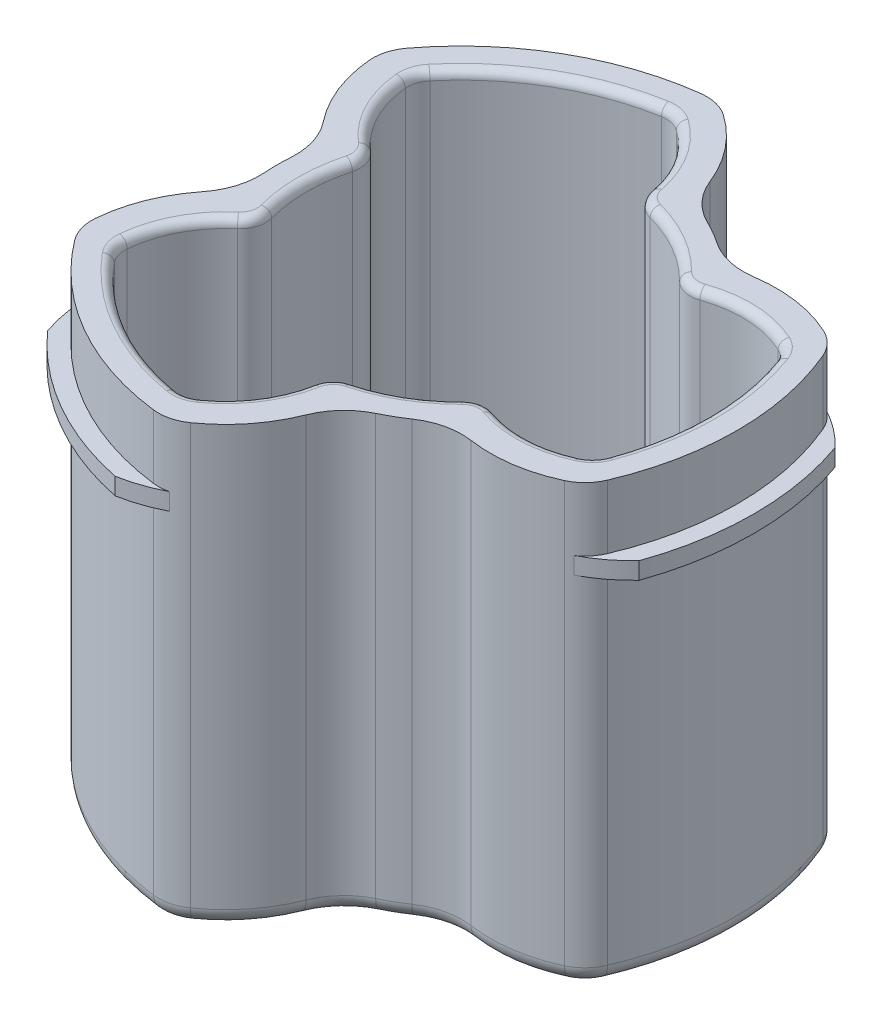
from build123d import *

# Parameters (mm, degrees)
DODANIE_WYCI_GNI_CIE1_DEPTH = 44.5
DODANIE_WYCI_GNI_CIE2_START = -7
DODANIE_WYCI_GNI_CIE2_DEPTH = 7
SZKIC2_R                    = 6.5
WYTNIJ_WYCI_GNI_CIE1_DEPTH  = 17
ZAOKR_GLENIE1_R             = 3
ZAOKR_GLENIE4_R             = 2
SFAZOWANIE2_SIZE            = 0.5
ZAOKR_GLENIE5_R             = 1
ZAOKR_GLENIE8_R             = 5
ZAOKR_GLENIE9_R             = 8
ZAOKR_GLENIE10_R            = 2
SZKIC3_W                    = 4
SZKIC3_H                    = 2
WYTNIJ_WYCI_GNI_CIE2_START  = -9.5
WYTNIJ_WYCI_GNI_CIE2_DEPTH  = 2


# Read off the part's stored shape, not the designer's step: Wytnij-wyciągnięcie2
with BuildPart() as part:
    # Szkic1 → Dodanie-wyciągnięcie1 (new body)
    with BuildSketch(Plane(origin=(0, 0, 0), x_dir=(1, 0, 0), z_dir=(0, 1, 0))):
        with BuildLine():
            ThreePointArc((29.172844828, -14.324633491), (32.5, 0), (29.172844828, 14.324633491))
            ThreePointArc((29.172844828, 14.324633491), (22.143469635, 16.74885428), (14.755110837, 15.911527399))
            ThreePointArc((14.755110837, 15.911527399), (10.85, 18.792751262), (6.402231522, 20.73406452))
            ThreePointArc((6.402231522, 20.73406452), (3.433198473, 27.551234372), (-2.18092591, 32.426741467))
            ThreePointArc((-2.18092591, 32.426741467), (-16.25, 28.145825623), (-26.991918917, 18.102107976))
            ThreePointArc((-26.991918917, 18.102107976), (-25.576668109, 10.802380092), (-21.157342359, 4.822537121))
            ThreePointArc((-21.157342359, 4.822537121), (-21.7, 0), (-21.157342359, -4.822537121))
            ThreePointArc((-21.157342359, -4.822537121), (-25.576668109, -10.802380092), (-26.991918917, -18.102107976))
            ThreePointArc((-26.991918917, -18.102107976), (-16.25, -28.145825623), (-2.18092591, -32.426741467))
            ThreePointArc((-2.18092591, -32.426741467), (3.433198473, -27.551234372), (6.402231522, -20.73406452))
            ThreePointArc((6.402231522, -20.73406452), (10.85, -18.792751262), (14.755110837, -15.911527399))
            ThreePointArc((14.755110837, -15.911527399), (22.143469635, -16.74885428), (29.172844828, -14.324633491))
        make_face()
        with BuildLine():
            ThreePointArc((26.797229064, -11.086411254), (29, 0), (26.797229064, 11.086411254))
            ThreePointArc((26.797229064, 11.086411254), (20.551461681, 12.847539337), (14.241564039, 11.332160152))
            ThreePointArc((14.241564039, 11.332160152), (9.1, 15.761662349), (2.693156552, 17.999636324))
            ThreePointArc((2.693156552, 17.999636324), (0.850564602, 24.22185757), (-3.797500749, 28.750286747))
            ThreePointArc((-3.797500749, 28.750286747), (-14.5, 25.11473671), (-22.999728315, 17.663875494))
            ThreePointArc((-22.999728315, 17.663875494), (-21.402026283, 11.374318232), (-16.934720591, 6.667476172))
            ThreePointArc((-16.934720591, 6.667476172), (-18.2, 0), (-16.934720591, -6.667476172))
            ThreePointArc((-16.934720591, -6.667476172), (-21.402026283, -11.374318232), (-22.999728315, -17.663875494))
            ThreePointArc((-22.999728315, -17.663875494), (-14.5, -25.11473671), (-3.797500749, -28.750286747))
            ThreePointArc((-3.797500749, -28.750286747), (0.850564602, -24.22185757), (2.693156552, -17.999636324))
            ThreePointArc((2.693156552, -17.999636324), (9.1, -15.761662349), (14.241564039, -11.332160152))
            ThreePointArc((14.241564039, -11.332160152), (20.551461681, -12.847539337), (26.797229064, -11.086411254))
        make_face(mode=Mode.SUBTRACT)
    extrude(amount=DODANIE_WYCI_GNI_CIE1_DEPTH)

    # Szkic1<2> → Dodanie-wyciągnięcie2 (add)
    with BuildSketch(Plane(origin=(0, 0, 0), x_dir=(1, 0, 0), z_dir=(0, 1, 0)).offset(DODANIE_WYCI_GNI_CIE2_START)):
        with BuildLine():
            ThreePointArc((29.172844828, -14.324633491), (32.5, 0), (29.172844828, 14.324633491))
            ThreePointArc((29.172844828, 14.324633491), (22.143469635, 16.74885428), (14.755110837, 15.911527399))
            ThreePointArc((14.755110837, 15.911527399), (10.85, 18.792751262), (6.402231522, 20.73406452))
            ThreePointArc((6.402231522, 20.73406452), (3.433198473, 27.551234372), (-2.18092591, 32.426741467))
            ThreePointArc((-2.18092591, 32.426741467), (-16.25, 28.145825623), (-26.991918917, 18.102107976))
            ThreePointArc((-26.991918917, 18.102107976), (-25.576668109, 10.802380092), (-21.157342359, 4.822537121))
            ThreePointArc((-21.157342359, 4.822537121), (-21.7, 0), (-21.157342359, -4.822537121))
            ThreePointArc((-21.157342359, -4.822537121), (-25.576668109, -10.802380092), (-26.991918917, -18.102107976))
            ThreePointArc((-26.991918917, -18.102107976), (-16.25, -28.145825623), (-2.18092591, -32.426741467))
            ThreePointArc((-2.18092591, -32.426741467), (3.433198473, -27.551234372), (6.402231522, -20.73406452))
            ThreePointArc((6.402231522, -20.73406452), (10.85, -18.792751262), (14.755110837, -15.911527399))
            ThreePointArc((14.755110837, -15.911527399), (22.143469635, -16.74885428), (29.172844828, -14.324633491))
        make_face()
    extrude(amount=DODANIE_WYCI_GNI_CIE2_DEPTH)

    # Szkic2 → Wytnij-wyciągnięcie1 (cut)
    with BuildSketch(Plane(origin=(0, -7, 0), x_dir=(-1, 0, 0), z_dir=(0, -1, 0))):
        with Locations(Location((-15, 0, 0), (0, 0, 90))):
            Circle(SZKIC2_R)
        with Locations(Location((7.5, 12.990381057, 0), (0, 0, 90))):
            Circle(SZKIC2_R)
        with Locations(Location((7.5, -12.990381057, 0), (0, 0, 90))):
            Circle(SZKIC2_R)
    extrude(amount=-WYTNIJ_WYCI_GNI_CIE1_DEPTH, mode=Mode.SUBTRACT)

    # Zaokrąglenie1
    zaokr_glenie1_edges = [part.edges().sort_by_distance(p)[0] for p in [
        (2.693156552, 22.25, -17.999636324),
        (-3.797500749, 22.25, -28.750286747),
        (-22.999728315, 22.25, -17.663875494),
        (-16.934720591, 22.25, -6.667476172),
        (-16.934720591, 22.25, 6.667476172),
        (-22.999728315, 22.25, 17.663875494),
        (-3.797500749, 22.25, 28.750286747),
        (2.693156552, 22.25, 17.999636324),
        (14.241564039, 22.25, 11.332160152),
        (26.797229064, 22.25, 11.086411254),
        (26.797229064, 22.25, -11.086411254),
        (14.241564039, 22.25, -11.332160152),
    ]]
    fillet(zaokr_glenie1_edges, radius=ZAOKR_GLENIE1_R)

    # Zaokrąglenie4
    zaokr_glenie4_edges = [part.edges().sort_by_distance(p)[0] for p in [
        (20.888894298, 0, -12.83649888),
        (9.1, 0, -15.761662349),
        (0.672286977, 0, -24.50856256),
        (-14.5, 0, -25.11473671),
        (-21.561181275, 0, -11.672063679),
        (-18.2, 0, 0),
        (-21.561181275, 0, 11.672063679),
        (-14.5, 0, 25.11473671),
        (0.672286977, 0, 24.50856256),
        (9.1, 0, 15.761662349),
        (20.888894298, 0, 12.83649888),
        (29, 0, 0),
        (26.613978722, 0, -10.987196446),
        (26.613978722, 0, 10.987196446),
        (-3.791798122, 0, 28.541979892),
        (-22.8221806, 0, 17.554783446),
        (-22.8221806, 0, -17.554783446),
        (-3.791798122, 0, -28.541979892),
        (14.3637981, 0, -12.024416577),
        (3.231551171, 0, -18.451622338),
        (-17.595349271, 0, -6.427205761),
        (-17.595349271, 0, 6.427205761),
        (3.231551171, 0, 18.451622338),
        (14.3637981, 0, 12.024416577),
    ]]
    fillet(zaokr_glenie4_edges, radius=ZAOKR_GLENIE4_R)

    # Sfazowanie2
    sfazowanie2_edges = [part.edges().sort_by_distance(p)[0] for p in [
        (15, 0, 6.5),
        (-7.5, 0, 19.490381057),
        (-7.5, 0, -6.490381057),
    ]]
    chamfer(sfazowanie2_edges, length=SFAZOWANIE2_SIZE)

    # Zaokrąglenie5
    zaokr_glenie5_edges = [part.edges().sort_by_distance(p)[0] for p in [
        (20.888894298, 44.5, -12.83649888),
        (9.1, 44.5, -15.761662349),
        (-14.5, 44.5, -25.11473671),
        (0.672286977, 44.5, -24.50856256),
        (29, 44.5, 0),
        (20.888894298, 44.5, 12.83649888),
        (9.1, 44.5, 15.761662349),
        (0.672286977, 44.5, 24.50856256),
        (-14.5, 44.5, 25.11473671),
        (-21.561181275, 44.5, 11.672063679),
        (-18.2, 44.5, 0),
        (-21.561181275, 44.5, -11.672063679),
        (14.3637981, 44.5, 12.024416577),
        (3.231551171, 44.5, 18.451622338),
        (-17.595349271, 44.5, 6.427205761),
        (-17.595349271, 44.5, -6.427205761),
        (3.231551171, 44.5, -18.451622338),
        (14.3637981, 44.5, -12.024416577),
        (-3.791798122, 44.5, -28.541979892),
        (-22.8221806, 44.5, -17.554783446),
        (-22.8221806, 44.5, 17.554783446),
        (-3.791798122, 44.5, 28.541979892),
        (26.613978722, 44.5, 10.987196446),
        (26.613978722, 44.5, -10.987196446),
    ]]
    fillet(zaokr_glenie5_edges, radius=ZAOKR_GLENIE5_R)

    # Zaokrąglenie8
    zaokr_glenie8_edges = [part.edges().sort_by_distance(p)[0] for p in [
        (-2.18092591, 18.75, 32.426741467),
        (-26.991918917, 18.75, 18.102107976),
        (-26.991918917, 18.75, -18.102107976),
        (-2.18092591, 18.75, -32.426741467),
        (29.172844828, 18.75, -14.324633491),
        (29.172844828, 18.75, 14.324633491),
    ]]
    fillet(zaokr_glenie8_edges, radius=ZAOKR_GLENIE8_R)

    # Zaokrąglenie9
    zaokr_glenie9_edges = [part.edges().sort_by_distance(p)[0] for p in [
        (14.755110837, 18.75, 15.911527399),
        (6.402231522, 18.75, 20.73406452),
        (-21.157342359, 18.75, 4.822537121),
        (-21.157342359, 18.75, -4.822537121),
        (6.402231522, 18.75, -20.73406452),
        (14.755110837, 18.75, -15.911527399),
    ]]
    fillet(zaokr_glenie9_edges, radius=ZAOKR_GLENIE9_R)

    # Zaokrąglenie10
    zaokr_glenie10_edges = [part.edges().sort_by_distance(p)[0] for p in [
        (-25.80839365, -7, -11.356393437),
        (3.069271613, -7, 28.02892125),
        (-16.25, -7, 28.145825623),
        (-16.25, -7, -28.145825623),
        (22.739122037, -7, -16.672527813),
        (32.5, -7, 0),
        (28.917195338, -7, 14.205889816),
        (28.917195338, -7, -14.205889816),
        (-2.155936205, -7, -32.145970677),
        (-2.155936205, -7, 32.145970677),
        (-26.761259133, -7, 17.940080861),
        (-26.761259133, -7, -17.940080861),
        (22.739122037, -7, 16.672527813),
        (10.85, -7, 18.792751262),
        (10.85, -7, -18.792751262),
        (3.069271613, -7, -28.02892125),
        (-21.7, -7, 0),
        (-25.80839365, -7, 11.356393437),
        (14.885332039, -7, 16.783707404),
        (7.092450962, -7, 21.282929391),
        (14.885332039, -7, -16.783707404),
        (7.092450962, -7, -21.282929391),
        (-21.977783001, -7, -4.499221987),
        (-21.977783001, -7, 4.499221987),
    ]]
    fillet(zaokr_glenie10_edges, radius=ZAOKR_GLENIE10_R)

    # Szkic3 → Obrót1 (revolve)
    with BuildSketch(Plane.XY, mode=Mode.PRIVATE) as obr_t1_sk:
        with Locations((32.5, 36)):
            Rectangle(SZKIC3_W, SZKIC3_H)
    revolve(obr_t1_sk.sketch.rotate(Axis((0, 0, 0), (0, 1, 0)), 90), axis=Axis((0, 0, 0), (0, 1, 0)))

    # Wytnij-wyciągnięcie2 outline → Wytnij-wyciągnięcie2 (cut)
    with BuildSketch(Plane(origin=(0, 44.5, 0), x_dir=(1, 0, 0), z_dir=(0, 1, 0)).offset(WYTNIJ_WYCI_GNI_CIE2_START)):
        with BuildLine():
            ThreePointArc((-6.26842561, 33.925754824), (-3.66136138, 33.076688461), (-1.227127446, 31.814863297))
            ThreePointArc((-1.227127446, 31.814863297), (-0.853780909, 31.618885297), (-0.498274373, 31.392147307))
            ThreePointArc((-0.498274373, 31.392147307), (0.098632719, 30.95521859), (0.675787586, 30.492512378))
            ThreePointArc((0.675787586, 30.492512378), (15.25, 26.413774815), (26.069396552, 15.831505406))
            ThreePointArc((26.069396552, 15.831505406), (26.758689319, 15.563027734), (27.435534233, 15.264555388))
            ThreePointArc((27.435534233, 15.264555388), (27.809648361, 15.070046692), (28.166043557, 14.844708106))
            ThreePointArc((28.166043557, 14.844708106), (30.475933171, 13.367512263), (32.514778325, 11.534261592))
            ThreePointArc((32.514778325, 11.534261592), (17.25, 29.877876431), (-6.26842561, 33.925754824))
        make_face()
        with BuildLine():
            ThreePointArc((-26.93891611, 16.970155191), (-26.814571791, 19.709176198), (-26.246352715, 22.391493232))
            ThreePointArc((-26.246352715, 22.391493232), (-34.498187486, -0.353638482), (-25.781818285, -22.924830336))
            ThreePointArc((-25.781818285, -22.924830336), (-26.452540762, -20.488059065), (-26.750123594, -17.978244863))
            ThreePointArc((-26.750123594, -17.978244863), (-26.930508836, -17.061697254), (-26.93725986, -16.127591918))
            ThreePointArc((-26.93725986, -16.127591918), (-26.857322037, -15.392190855), (-26.745184138, -14.661006972))
            ThreePointArc((-26.745184138, -14.661006972), (-30.5, 0), (-26.745184138, 14.661006972))
            ThreePointArc((-26.745184138, 14.661006972), (-26.857322037, 15.392190855), (-26.93725986, 16.127591918))
            ThreePointArc((-26.93725986, 16.127591918), (-26.955867452, 16.548838605), (-26.93891611, 16.970155191))
        make_face()
        with BuildLine():
            ThreePointArc((-6.962576305, -33.790124759), (16.942833834, -30.053125988), (32.514778325, -11.534261592))
            ThreePointArc((32.514778325, -11.534261592), (30.475933171, -13.367512263), (28.166043557, -14.844708106))
            ThreePointArc((28.166043557, -14.844708106), (27.809648361, -15.070046692), (27.435534233, -15.264555388))
            ThreePointArc((27.435534233, -15.264555388), (26.758689319, -15.563027734), (26.069396552, -15.831505406))
            ThreePointArc((26.069396552, -15.831505406), (15.25, -26.413774815), (0.675787586, -30.492512378))
            ThreePointArc((0.675787586, -30.492512378), (0.098632719, -30.95521859), (-0.498274373, -31.392147307))
            ThreePointArc((-0.498274373, -31.392147307), (-1.310608836, -31.853353416), (-2.19455497, -32.155409018))
            ThreePointArc((-2.19455497, -32.155409018), (-4.516909243, -33.152601827), (-6.962576305, -33.790124759))
        make_face()
    extrude(amount=WYTNIJ_WYCI_GNI_CIE2_DEPTH, mode=Mode.SUBTRACT)


solid = part.part
